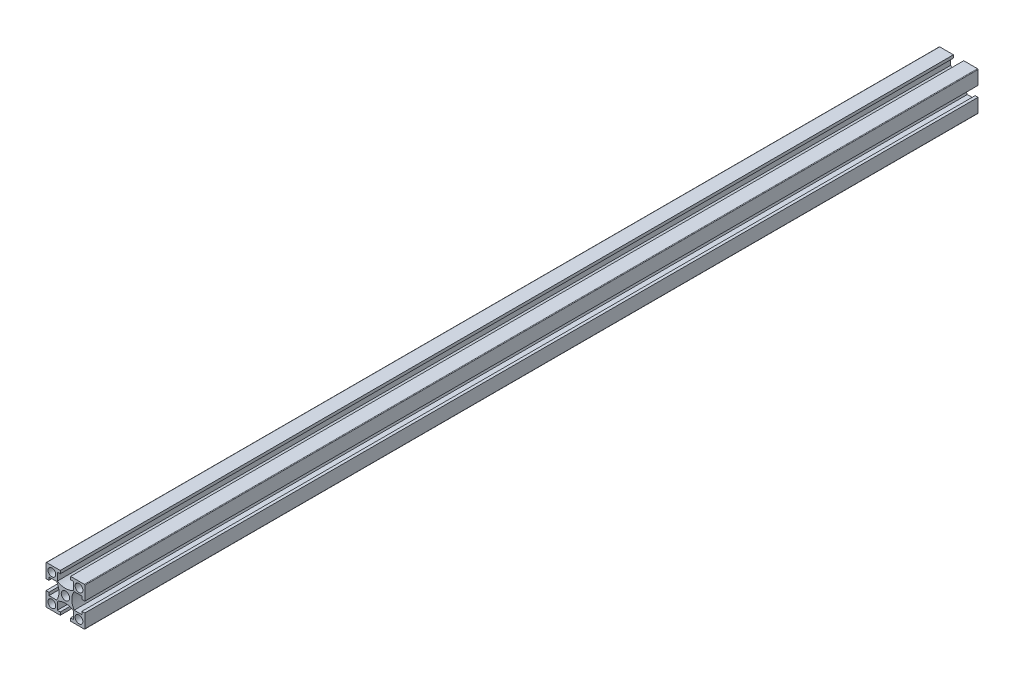
from build123d import *

# Parameters (mm, degrees)
SKETCH_1_W               = 20
SKETCH_1_H               = 20
SKETCH_1_R               = 2
SKETCH_1_R_2             = 2.15
EXTRUDE_1_DEPTH          = 460
CUT_EXTRUDE_1_REACH      = 462.217
PATTERN_CIRCULAR_1_COUNT = 4
FILLET_1_R               = 0.3
SKETCH_3_R               = 2.15
CUT_EXTRUDE_3_DEPTH      = 461.543157587
SKETCH_4_R               = 2.15
CUT_EXTRUDE_4_DEPTH      = 461.543157687
SKETCH_5_R               = 2.5
CUT_EXTRUDE_5_DEPTH      = 461.543157687
SKETCH_6_R               = 2.5
CUT_EXTRUDE_9_DEPTH      = 7


with BuildPart() as part:
    # 스케치1 → 보스-돌출1 (new body)
    with BuildSketch(Plane.XY):
        Rectangle(SKETCH_1_W, SKETCH_1_H)
        with Locations((-7, -7)):
            Circle(SKETCH_1_R, mode=Mode.SUBTRACT)
        with Locations((7, -7)):
            Circle(SKETCH_1_R, mode=Mode.SUBTRACT)
        with Locations((-7, 7)):
            Circle(SKETCH_1_R, mode=Mode.SUBTRACT)
        Circle(SKETCH_1_R_2, mode=Mode.SUBTRACT)
        with Locations((7, 7)):
            Circle(SKETCH_1_R, mode=Mode.SUBTRACT)
    extrude(amount=EXTRUDE_1_DEPTH)

    # 스케치1<3> → 컷-돌출1 (cut, up to next)
    with BuildSketch(Plane.XY, mode=Mode.PRIVATE) as cut_extrude_1_sk1:
        with BuildLine():
            Line((-8.5, 2.65), (-10, 2.65))
            Line((-10, 2.65), (-10, -2.65))
            Line((-10, -2.65), (-8.5, -2.65))
            Line((-8.5, -2.65), (-8.5, -4.15))
            Line((-8.5, -4.15), (-4.503166667, -4.15))
            ThreePointArc((-4.503166667, -4.15), (-3.3, 0), (-4.503166667, 4.15))
            Line((-4.503166667, 4.15), (-8.5, 4.15))
            Line((-8.5, 4.15), (-8.5, 2.65))
        make_face()
    cut_extrude_1_tool1 = extrude(cut_extrude_1_sk1.sketch, amount=CUT_EXTRUDE_1_REACH, mode=Mode.PRIVATE) & part.part
    cut_extrude_1 = cut_extrude_1_tool1.solids().sort_by_distance((-6.606913, 0, 0))[0]
    add(cut_extrude_1, mode=Mode.SUBTRACT)

    # 원형 패턴1: 컷-돌출1 ×4 about axis
    pattern_circular_1_axis = Axis((0, 0, 460), (0, 0, -1))
    for i in range(1, PATTERN_CIRCULAR_1_COUNT):
        add(cut_extrude_1.rotate(pattern_circular_1_axis, i * 360 / PATTERN_CIRCULAR_1_COUNT), mode=Mode.SUBTRACT)

    # 필렛1
    fillet_1_edges = [part.edges().sort_by_distance(p)[0] for p in [
        (10, -10, 230),
        (-10, -10, 230),
        (-10, 10, 230),
        (10, 10, 230),
    ]]
    fillet(fillet_1_edges, radius=FILLET_1_R)

    # 스케치3 → 컷-돌출3 (cut, through all)
    with BuildSketch(Plane(origin=(0, 10, 0), x_dir=(1, 0, 0), z_dir=(0, 1, 0))):
        with Locations((0, -10)):
            Circle(SKETCH_3_R)
        with Locations((0, -450)):
            Circle(SKETCH_3_R)
    extrude(amount=-CUT_EXTRUDE_3_DEPTH, mode=Mode.SUBTRACT)

    # 스케치4 → 컷-돌출4 (cut, through all)
    with BuildSketch(Plane.ZY.offset(10)):
        with Locations((10, 0)):
            Circle(SKETCH_4_R)
        with Locations((450, 0)):
            Circle(SKETCH_4_R)
    extrude(amount=-CUT_EXTRUDE_4_DEPTH, mode=Mode.SUBTRACT)

    # 스케치5 → 컷-돌출5 (cut, through all)
    with BuildSketch(Plane.ZY.offset(10)):
        with Locations((190.5, 0)):
            Circle(SKETCH_5_R)
        with Locations((269.5, 0)):
            Circle(SKETCH_5_R)
    extrude(amount=-CUT_EXTRUDE_5_DEPTH, mode=Mode.SUBTRACT)

    # 스케치6 → 컷-돌출9 (cut)
    with BuildSketch(Plane.XZ.offset(10)):
        with Locations((0, 190.5)):
            Circle(SKETCH_6_R)
        with Locations((0, 269.5)):
            Circle(SKETCH_6_R)
    extrude(amount=-CUT_EXTRUDE_9_DEPTH, mode=Mode.SUBTRACT)


solid = part.part
